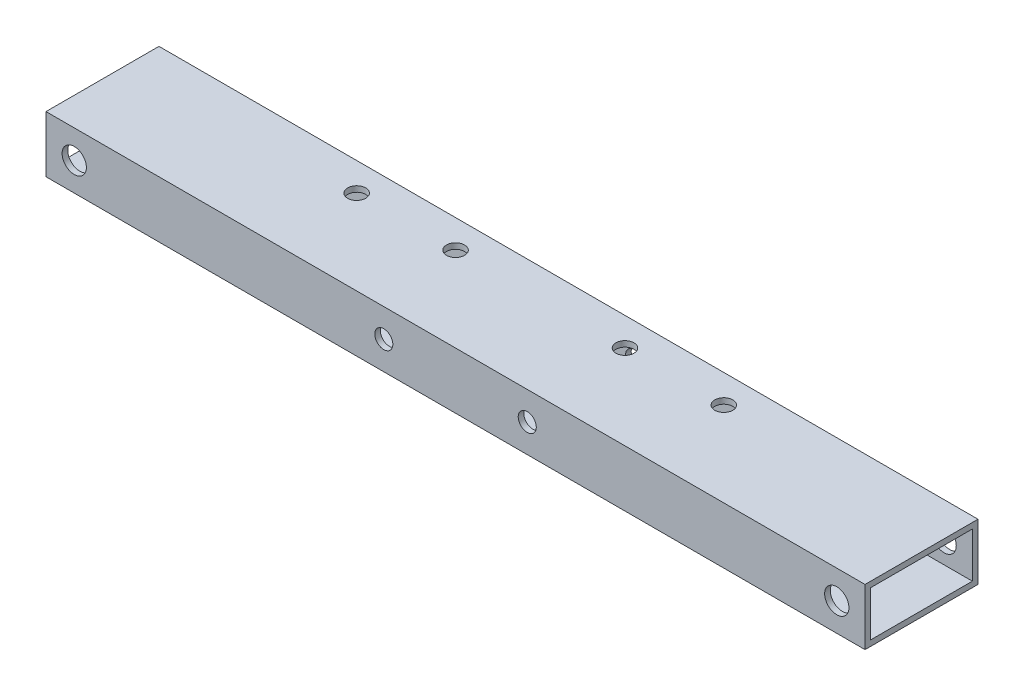
from build123d import *

# Parameters (mm, degrees)
SKETCH_1_W          = 20
SKETCH_1_H          = 10
SKETCH_1_W_2        = 18
SKETCH_1_H_2        = 8
EXTRUDE_1_DEPTH     = 145
SKETCH_2_R          = 2.15
SKETCH_2_R_2        = 1.6
CUT_EXTRUDE_1_DEPTH = 147.458185159
SKETCH_3_R          = 1.6
CUT_EXTRUDE_2_DEPTH = 146.688022843


with BuildPart() as part:
    # ｽｹｯﾁ1 → 押し出し-薄板1 (new body)
    with BuildSketch(Plane(origin=(0, 0, 0), x_dir=(0, 0, -1), z_dir=(1, 0, 0))):
        Rectangle(SKETCH_1_W, SKETCH_1_H)
        Rectangle(SKETCH_1_W_2, SKETCH_1_H_2, mode=Mode.SUBTRACT)
    extrude(amount=EXTRUDE_1_DEPTH)

    # ｽｹｯﾁ2 → ｶｯﾄ - 押し出し1 (cut, through all)
    with BuildSketch(Plane.XY.offset(10)):
        with Locations((140, 0)):
            Circle(SKETCH_2_R)
        with Locations((85.2, 0)):
            Circle(SKETCH_2_R_2)
        with Locations((5, 0)):
            Circle(SKETCH_2_R)
        with Locations((59.8, 0)):
            Circle(SKETCH_2_R_2)
    extrude(amount=-CUT_EXTRUDE_1_DEPTH, mode=Mode.SUBTRACT)

    # ｽｹｯﾁ3 → ｶｯﾄ - 押し出し2 (cut, through all)
    with BuildSketch(Plane(origin=(0, 5, 0), x_dir=(1, 0, 0), z_dir=(0, 1, 0))):
        with Locations((105, 5)):
            Circle(SKETCH_3_R)
        with Locations((40, 5)):
            Circle(SKETCH_3_R)
        with Locations((87.5, 5)):
            Circle(SKETCH_3_R)
        with Locations((57.5, 5)):
            Circle(SKETCH_3_R)
    extrude(amount=-CUT_EXTRUDE_2_DEPTH, mode=Mode.SUBTRACT)


solid = part.part
